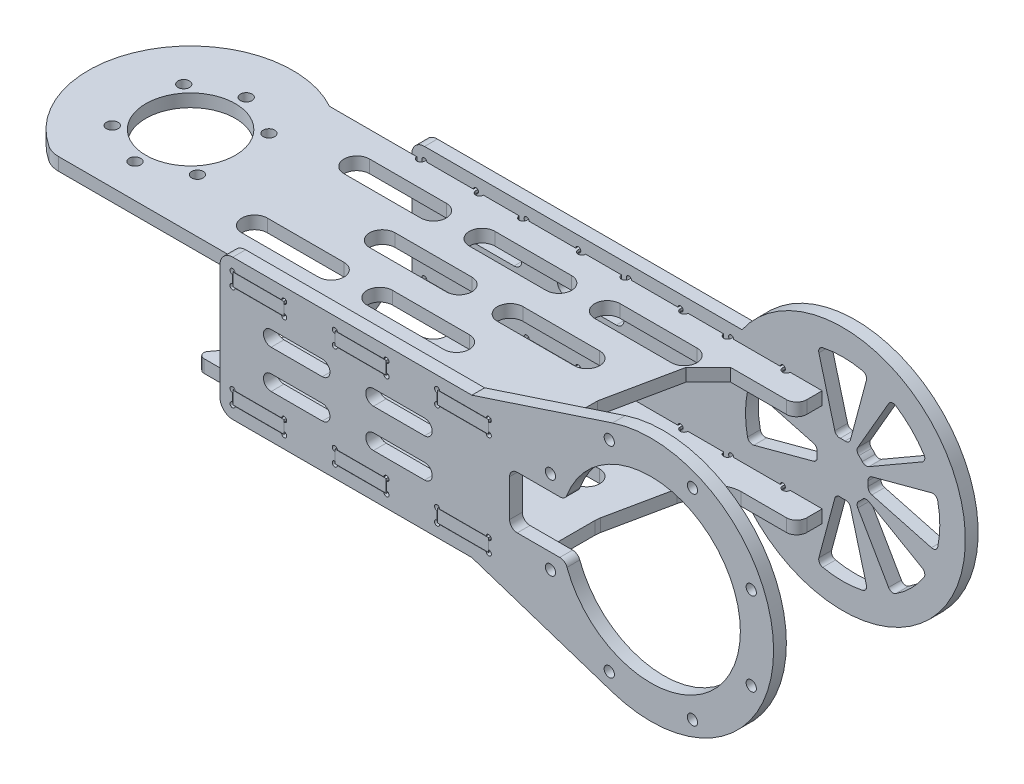
from build123d import *

# Parameters (mm, degrees)
SKETCH_1_W             = 270
SKETCH_1_H             = 5
EXTRUDE_1_DEPTH        = 200
SKETCH_2_R             = 2.25
SKETCH_2_R_2           = 17.5
CUT_EXTRUDE_1_DEPTH    = 10
FILLET_4_R             = 10
SKETCH_5_W             = 160
SKETCH_5_H             = 6
EXTRUDE_1_2_DEPTH      = 5
CUT_EXTRUDE_2_DEPTH    = 5
CUT_EXTRUDE_3_DEPTH    = 5
PATTERN_LINEAR_1_COUNT = 2
PATTERN_LINEAR_1_PITCH = 40
EXTRUDE_2_DEPTH        = 5
FILLET_5_R             = 5
CUT_EXTRUDE_4_DEPTH    = 347.258934903
FILLET_6_R             = 10
PATTERN_LINEAR_2_COUNT = 2
PATTERN_LINEAR_2_PITCH = 75
FILLET_9_R             = 4
FILLET_10_R            = 4
SKETCH_10_W            = 28.430397339
SKETCH_10_H            = 10.57159179
SKETCH_10_H_2          = 10.982139044
EXTRUDE_3_DEPTH        = 5
SKETCH_11_R            = 2
CUT_EXTRUDE_5_DEPTH    = 10
EXTRUDE_4_DEPTH        = 5
CUT_EXTRUDE_6_DEPTH    = 5
SKETCH_14_W            = 30.299348818
SKETCH_14_H            = 10.518193802
CUT_EXTRUDE_7_DEPTH    = 347.258934903
FILLET_11_R            = 4
CUT_EXTRUDE_8_DEPTH    = 290.119784864
SKETCH_16_R            = 50
CUT_EXTRUDE_9_DEPTH    = 5
EXTRUDE_5_DEPTH        = 5
FILLET_12_R            = 2


with BuildPart() as part:
    # 草图1 → Extrude 1 (new body)
    with BuildSketch(Plane.XY):
        with Locations((-135, -2.5)):
            Rectangle(SKETCH_1_W, SKETCH_1_H)
    extrude(amount=EXTRUDE_1_DEPTH)

    # 草图2 → 切除-拉伸1 (cut)
    with BuildSketch(Plane(origin=(0, 0, 0), x_dir=(1, 0, 0), z_dir=(0, 1, 0))):
        with BuildLine():
            Line((-270, 0), (-270, -165))
            ThreePointArc((-270, -165), (-250.315060063, -130.542804313), (-210.635083269, -130))
            Line((-210.635083269, -130), (0, -130))
            Line((0, -130), (0, 0))
            Line((0, 0), (-270, 0))
        make_face()
        with BuildLine():
            ThreePointArc((-249.364916731, -200), (-264.457195687, -185.315060063), (-270, -165))
            Line((-270, -165), (-270, -200))
            Line((-270, -200), (-249.364916731, -200))
        make_face()
        with Locations(Location((-246.661466638, -178.980630511, 0), (0, 0, 270))):
            Circle(SKETCH_2_R)
        with Locations(Location((-230, -165, 0), (0, 0, 270))):
            Circle(SKETCH_2_R_2)
        with Locations(Location((-246.661466638, -151.019369489, 0), (0, 0, 270))):
            Circle(SKETCH_2_R)
        with Locations(Location((-230, -143.25, 0), (0, 0, 270))):
            Circle(SKETCH_2_R)
        with Locations(Location((-213.338533362, -151.019369489, 0), (0, 0, 270))):
            Circle(SKETCH_2_R)
        with Locations(Location((-213.338533362, -178.980630511, 0), (0, 0, 270))):
            Circle(SKETCH_2_R)
        with Locations(Location((-230, -186.75, 0), (0, 0, 270))):
            Circle(SKETCH_2_R)
    extrude(amount=-CUT_EXTRUDE_1_DEPTH, mode=Mode.SUBTRACT)

    # 圆角4
    fillet_4_edges = [part.edges().sort_by_distance(p)[0] for p in [
        (-249.364916731, -2.5, 200),
    ]]
    fillet(fillet_4_edges, radius=FILLET_4_R)

    # 草图5 → Extrude 1 2 (add)
    with BuildSketch(Plane.XZ.offset(5)):
        with Locations((-100, 203)):
            Rectangle(SKETCH_5_W, SKETCH_5_H)
        with Locations((-100, 127)):
            Rectangle(SKETCH_5_W, SKETCH_5_H)
    extrude(amount=-EXTRUDE_1_2_DEPTH)

    # 草图6 → 切除-拉伸2 (cut)
    with BuildSketch(Plane.XZ.offset(5)):
        with BuildLine():
            Line((-180, 200), (-176.5, 200))
            ThreePointArc((-176.5, 200), (-175, 198.5), (-173.5, 200))
            Line((-173.5, 200), (-173.5, 205))
            Line((-173.5, 205), (-153.5, 205))
            Line((-153.5, 205), (-153.5, 200))
            ThreePointArc((-153.5, 200), (-152, 198.5), (-150.5, 200))
            Line((-150.5, 200), (-136.5, 200))
            ThreePointArc((-136.5, 200), (-135, 198.5), (-133.5, 200))
            Line((-133.5, 200), (-133.5, 205))
            Line((-133.5, 205), (-113.5, 205))
            Line((-113.5, 205), (-113.5, 200))
            ThreePointArc((-113.5, 200), (-112, 198.5), (-110.5, 200))
            Line((-110.5, 200), (-96.5, 200))
            ThreePointArc((-96.5, 200), (-95, 198.5), (-93.5, 200))
            Line((-93.5, 200), (-93.5, 205))
            Line((-93.5, 205), (-73.5, 205))
            Line((-73.5, 205), (-73.5, 200))
            ThreePointArc((-73.5, 200), (-72, 198.5), (-70.5, 200))
            Line((-70.5, 200), (-56.5, 200))
            ThreePointArc((-56.5, 200), (-55, 198.5), (-53.5, 200))
            Line((-53.5, 200), (-53.5, 205))
            Line((-53.5, 205), (-33.5, 205))
            Line((-33.5, 205), (-33.5, 200))
            ThreePointArc((-33.5, 200), (-32, 198.5), (-30.5, 200))
            Line((-30.5, 200), (-20, 200))
            Line((-20, 200), (-20, 206))
            Line((-20, 206), (-180, 206))
            Line((-180, 206), (-180, 200))
        make_face()
        with BuildLine():
            Line((-20, 124), (-20, 130))
            Line((-20, 130), (-30.5, 130))
            ThreePointArc((-30.5, 130), (-32, 131.5), (-33.5, 130))
            Line((-33.5, 130), (-33.5, 125))
            Line((-33.5, 125), (-53.5, 125))
            Line((-53.5, 125), (-53.5, 130))
            ThreePointArc((-53.5, 130), (-55, 131.5), (-56.5, 130))
            Line((-56.5, 130), (-70.5, 130))
            ThreePointArc((-70.5, 130), (-72, 131.5), (-73.5, 130))
            Line((-73.5, 130), (-73.5, 125))
            Line((-73.5, 125), (-93.5, 125))
            Line((-93.5, 125), (-93.5, 130))
            ThreePointArc((-93.5, 130), (-95, 131.5), (-96.5, 130))
            Line((-96.5, 130), (-110.5, 130))
            ThreePointArc((-110.5, 130), (-112, 131.5), (-113.5, 130))
            Line((-113.5, 130), (-113.5, 125))
            Line((-113.5, 125), (-133.5, 125))
            Line((-133.5, 125), (-133.5, 130))
            ThreePointArc((-133.5, 130), (-135, 131.5), (-136.5, 130))
            Line((-136.5, 130), (-150.5, 130))
            ThreePointArc((-150.5, 130), (-152, 131.5), (-153.5, 130))
            Line((-153.5, 130), (-153.5, 125))
            Line((-153.5, 125), (-173.5, 125))
            Line((-173.5, 125), (-173.5, 130))
            ThreePointArc((-173.5, 130), (-175, 131.5), (-176.5, 130))
            Line((-176.5, 130), (-180, 130))
            Line((-180, 130), (-180, 124))
            Line((-180, 124), (-20, 124))
        make_face()
    extrude(amount=-CUT_EXTRUDE_2_DEPTH, mode=Mode.SUBTRACT)

    # 草图7 → 切除-拉伸3 (cut)
    with BuildSketch(Plane.XZ.offset(5)):
        with BuildLine():
            Line((-185, 190), (-155, 190))
            ThreePointArc((-155, 190), (-150, 185), (-155, 180))
            Line((-155, 180), (-185, 180))
            ThreePointArc((-185, 180), (-190, 185), (-185, 190))
        make_face()
        with BuildLine():
            Line((-136, 190), (-106, 190))
            ThreePointArc((-106, 190), (-101, 185), (-106, 180))
            Line((-106, 180), (-136, 180))
            ThreePointArc((-136, 180), (-141, 185), (-136, 190))
        make_face()
        with BuildLine():
            Line((-155, 170), (-125, 170))
            ThreePointArc((-125, 170), (-120, 165), (-125, 160))
            Line((-125, 160), (-155, 160))
            ThreePointArc((-155, 160), (-160, 165), (-155, 170))
        make_face()
        with BuildLine():
            Line((-105, 170), (-75, 170))
            ThreePointArc((-75, 170), (-70, 165), (-75, 160))
            Line((-75, 160), (-105, 160))
            ThreePointArc((-105, 160), (-110, 165), (-105, 170))
        make_face()
        with BuildLine():
            Line((-87, 140), (-57, 140))
            ThreePointArc((-57, 140), (-52, 145), (-57, 150))
            Line((-57, 150), (-87, 150))
            ThreePointArc((-87, 150), (-92, 145), (-87, 140))
        make_face()
        with BuildLine():
            Line((-136, 140), (-106, 140))
            ThreePointArc((-106, 140), (-101, 145), (-106, 150))
            Line((-106, 150), (-136, 150))
            ThreePointArc((-136, 150), (-141, 145), (-136, 140))
        make_face()
        with BuildLine():
            Line((-185, 140), (-155, 140))
            ThreePointArc((-155, 140), (-150, 145), (-155, 150))
            Line((-155, 150), (-185, 150))
            ThreePointArc((-185, 150), (-190, 145), (-185, 140))
        make_face()
    extrude(amount=-CUT_EXTRUDE_3_DEPTH, mode=Mode.SUBTRACT)


with BuildPart() as pattern_linear_1_1:
    # 阵列(线性)1: pattern copy
    add(part.part.moved(Location(Vector(0, 1, 0) * (1 * PATTERN_LINEAR_1_PITCH))))


with BuildPart() as body_3:
    # 草图8 → 凸台-拉伸2 (new body)
    with BuildSketch(Plane.XY.offset(205)):
        with BuildLine():
            Line((-178.5, 45), (-49.341453964, 45))
            ThreePointArc((-49.341453964, 45), (38, 17.5), (-49.341453964, -10))
            Line((-49.341453964, -10), (-178.5, -10))
            Line((-178.5, -10), (-178.5, 45))
        make_face()
        with BuildLine():
            Line((-173.6, -0.9), (-173.6, -4.1))
            ThreePointArc((-173.6, -4.1), (-174.307106781, -5.807106781), (-172.6, -5.1))
            Line((-172.6, -5.1), (-154.4, -5.1))
            ThreePointArc((-154.4, -5.1), (-152.692893219, -5.807106781), (-153.4, -4.1))
            Line((-153.4, -4.1), (-153.4, -0.9))
            ThreePointArc((-153.4, -0.9), (-152.692893219, 0.807106781), (-154.4, 0.1))
            Line((-154.4, 0.1), (-172.6, 0.1))
            ThreePointArc((-172.6, 0.1), (-174.307106781, 0.807106781), (-173.6, -0.9))
        make_face(mode=Mode.SUBTRACT)
        with BuildLine():
            Line((-133.6, -0.9), (-133.6, -4.1))
            ThreePointArc((-133.6, -4.1), (-134.307106781, -5.807106781), (-132.6, -5.1))
            Line((-132.6, -5.1), (-114.4, -5.1))
            ThreePointArc((-114.4, -5.1), (-112.692893219, -5.807106781), (-113.4, -4.1))
            Line((-113.4, -4.1), (-113.4, -0.9))
            ThreePointArc((-113.4, -0.9), (-112.692893219, 0.807106781), (-114.4, 0.1))
            Line((-114.4, 0.1), (-132.6, 0.1))
            ThreePointArc((-132.6, 0.1), (-134.307106781, 0.807106781), (-133.6, -0.9))
        make_face(mode=Mode.SUBTRACT)
        with BuildLine():
            Line((-93.6, -0.9), (-93.6, -4.1))
            ThreePointArc((-93.6, -4.1), (-94.307106781, -5.807106781), (-92.6, -5.1))
            Line((-92.6, -5.1), (-74.4, -5.1))
            ThreePointArc((-74.4, -5.1), (-72.692893219, -5.807106781), (-73.4, -4.1))
            Line((-73.4, -4.1), (-73.4, -0.9))
            ThreePointArc((-73.4, -0.9), (-72.692893219, 0.807106781), (-74.4, 0.1))
            Line((-74.4, 0.1), (-92.6, 0.1))
            ThreePointArc((-92.6, 0.1), (-94.307106781, 0.807106781), (-93.6, -0.9))
        make_face(mode=Mode.SUBTRACT)
        with BuildLine():
            Line((-53.6, -0.9), (-53.6, -4.1))
            ThreePointArc((-53.6, -4.1), (-54.307106781, -5.807106781), (-52.6, -5.1))
            Line((-52.6, -5.1), (-34.4, -5.1))
            ThreePointArc((-34.4, -5.1), (-32.692893219, -5.807106781), (-33.4, -4.1))
            Line((-33.4, -4.1), (-33.4, -0.9))
            ThreePointArc((-33.4, -0.9), (-32.692893219, 0.807106781), (-34.4, 0.1))
            Line((-34.4, 0.1), (-52.6, 0.1))
            ThreePointArc((-52.6, 0.1), (-54.307106781, 0.807106781), (-53.6, -0.9))
        make_face(mode=Mode.SUBTRACT)
        with BuildLine():
            Line((-133.6, 39.1), (-133.6, 35.9))
            ThreePointArc((-133.6, 35.9), (-134.307106781, 34.192893219), (-132.6, 34.9))
            Line((-132.6, 34.9), (-114.4, 34.9))
            ThreePointArc((-114.4, 34.9), (-112.692893219, 34.192893219), (-113.4, 35.9))
            Line((-113.4, 35.9), (-113.4, 39.1))
            ThreePointArc((-113.4, 39.1), (-112.692893219, 40.807106781), (-114.4, 40.1))
            Line((-114.4, 40.1), (-132.6, 40.1))
            ThreePointArc((-132.6, 40.1), (-134.307106781, 40.807106781), (-133.6, 39.1))
        make_face(mode=Mode.SUBTRACT)
        with BuildLine():
            Line((-93.6, 39.1), (-93.6, 35.9))
            ThreePointArc((-93.6, 35.9), (-94.307106781, 34.192893219), (-92.6, 34.9))
            Line((-92.6, 34.9), (-74.4, 34.9))
            ThreePointArc((-74.4, 34.9), (-72.692893219, 34.192893219), (-73.4, 35.9))
            Line((-73.4, 35.9), (-73.4, 39.1))
            ThreePointArc((-73.4, 39.1), (-72.692893219, 40.807106781), (-74.4, 40.1))
            Line((-74.4, 40.1), (-92.6, 40.1))
            ThreePointArc((-92.6, 40.1), (-94.307106781, 40.807106781), (-93.6, 39.1))
        make_face(mode=Mode.SUBTRACT)
        with BuildLine():
            Line((-53.6, 39.1), (-53.6, 35.9))
            ThreePointArc((-53.6, 35.9), (-54.307106781, 34.192893219), (-52.6, 34.9))
            Line((-52.6, 34.9), (-34.4, 34.9))
            ThreePointArc((-34.4, 34.9), (-32.692893219, 34.192893219), (-33.4, 35.9))
            Line((-33.4, 35.9), (-33.4, 39.1))
            ThreePointArc((-33.4, 39.1), (-32.692893219, 40.807106781), (-34.4, 40.1))
            Line((-34.4, 40.1), (-52.6, 40.1))
            ThreePointArc((-52.6, 40.1), (-54.307106781, 40.807106781), (-53.6, 39.1))
        make_face(mode=Mode.SUBTRACT)
        with BuildLine():
            Line((-173.6, 39.1), (-173.6, 35.9))
            ThreePointArc((-173.6, 35.9), (-174.307106781, 34.192893219), (-172.6, 34.9))
            Line((-172.6, 34.9), (-154.4, 34.9))
            ThreePointArc((-154.4, 34.9), (-152.692893219, 34.192893219), (-153.4, 35.9))
            Line((-153.4, 35.9), (-153.4, 39.1))
            ThreePointArc((-153.4, 39.1), (-152.692893219, 40.807106781), (-154.4, 40.1))
            Line((-154.4, 40.1), (-172.6, 40.1))
            ThreePointArc((-172.6, 40.1), (-174.307106781, 40.807106781), (-173.6, 39.1))
        make_face(mode=Mode.SUBTRACT)
    extrude(amount=-EXTRUDE_2_DEPTH)

    # 圆角5
    fillet_5_edges = [body_3.edges().sort_by_distance(p)[0] for p in [
        (-178.5, 45, 202.5),
        (-178.5, -10, 202.5),
    ]]
    fillet(fillet_5_edges, radius=FILLET_5_R)


with BuildPart() as cut_extrude_4_tool:
    # 草图9 → 切除-拉伸4 (new, through all)
    with BuildSketch(Plane(origin=(0, 40, 0), x_dir=(1, 0, 0), z_dir=(0, 1, 0))):
        Polygon((-58.5, -217.937724261), (0, -217.937724261), (0, -140), (-43.841989731, -140), (-52.541893066, -148.699903335), (-58.5, -177.324686964), align=None)
    extrude(amount=-CUT_EXTRUDE_4_DEPTH)


with BuildPart() as pattern_linear_1_1_1:
    add(pattern_linear_1_1.part)

    # 切除-拉伸4: cut by cut_extrude_4_tool
    add(cut_extrude_4_tool.part, mode=Mode.SUBTRACT)

    # 圆角10
    fillet_10_edges = [pattern_linear_1_1_1.edges().sort_by_distance(p)[0] for p in [
        (0, 37.5, 140),
    ]]
    fillet(fillet_10_edges, radius=FILLET_10_R)


with BuildPart() as part_1:
    add(part.part)

    # 切除-拉伸4: cut by cut_extrude_4_tool
    add(cut_extrude_4_tool.part, mode=Mode.SUBTRACT)

    # 圆角6
    fillet_6_edges = [part_1.edges().sort_by_distance(p)[0] for p in [
        (-58.5, -2.5, 177.324686964),
        (-52.541893066, -2.5, 148.699903335),
        (-43.841989731, -2.5, 140),
    ]]
    fillet(fillet_6_edges, radius=FILLET_6_R)

    # 圆角9
    fillet_9_edges = [part_1.edges().sort_by_distance(p)[0] for p in [
        (0, -2.5, 140),
    ]]
    fillet(fillet_9_edges, radius=FILLET_9_R)


with BuildPart() as pattern_linear_2_1:
    # 阵列(线性)2: pattern copy
    add(body_3.part.moved(Location(Vector(0, 0, -1) * (1 * PATTERN_LINEAR_2_PITCH))))

    # 草图13 → 切除-拉伸6 (cut)
    with BuildSketch(Plane(origin=(0, 0, 125), x_dir=(-1, 0, 0), z_dir=(0, 0, -1))):
        with BuildLine():
            Line((-21.128764833, 35.472200756), (-0.246950766, 23.416079783))
            ThreePointArc((-0.246950766, 23.416079783), (1.107320607, 23.179757711), (2.294207695, 23.873442159))
            ThreePointArc((2.294207695, 23.873442159), (2.928932188, 24.571067812), (3.626557841, 25.205792305))
            ThreePointArc((3.626557841, 25.205792305), (4.320242289, 26.392679393), (4.083920217, 27.746950766))
            Line((4.083920217, 27.746950766), (-7.972200756, 48.628764833))
            ThreePointArc((-7.972200756, 48.628764833), (-9.240496649, 49.574254843), (-10.798932206, 49.302585101))
            ThreePointArc((-10.798932206, 49.302585101), (-16.870057685, 44.370057685), (-21.802585101, 38.298932206))
            ThreePointArc((-21.802585101, 38.298932206), (-22.074254843, 36.740496649), (-21.128764833, 35.472200756))
        make_face()
        with BuildLine():
            Line((0.696904324, 52.21962573), (6.93761176, 28.928988506))
            ThreePointArc((6.93761176, 28.928988506), (7.728121291, 27.804269095), (9.057886177, 27.455522163))
            ThreePointArc((9.057886177, 27.455522163), (10, 27.5), (10.942113823, 27.455522163))
            ThreePointArc((10.942113823, 27.455522163), (12.271878709, 27.804269095), (13.06238824, 28.928988506))
            Line((13.06238824, 28.928988506), (19.303095676, 52.21962573))
            ThreePointArc((19.303095676, 52.21962573), (19.074837447, 53.785008755), (17.78075758, 54.694889588))
            ThreePointArc((17.78075758, 54.694889588), (10, 55.5), (2.21924242, 54.694889588))
            ThreePointArc((2.21924242, 54.694889588), (0.925162553, 53.785008755), (0.696904324, 52.21962573))
        make_face()
        with BuildLine():
            Line((44.71962573, 26.803095676), (21.428988506, 20.56238824))
            ThreePointArc((21.428988506, 20.56238824), (20.304269095, 19.771878709), (19.955522163, 18.442113823))
            ThreePointArc((19.955522163, 18.442113823), (20, 17.5), (19.955522163, 16.557886177))
            ThreePointArc((19.955522163, 16.557886177), (20.304269095, 15.228121291), (21.428988506, 14.43761176))
            Line((21.428988506, 14.43761176), (44.71962573, 8.196904324))
            ThreePointArc((44.71962573, 8.196904324), (46.285008755, 8.425162553), (47.194889588, 9.71924242))
            ThreePointArc((47.194889588, 9.71924242), (48, 17.5), (47.194889588, 25.28075758))
            ThreePointArc((47.194889588, 25.28075758), (46.285008755, 26.574837447), (44.71962573, 26.803095676))
        make_face()
        with BuildLine():
            Line((19.303095676, -17.21962573), (13.06238824, 6.071011494))
            ThreePointArc((13.06238824, 6.071011494), (12.271878709, 7.195730905), (10.942113823, 7.544477837))
            ThreePointArc((10.942113823, 7.544477837), (10, 7.5), (9.057886177, 7.544477837))
            ThreePointArc((9.057886177, 7.544477837), (7.728121291, 7.195730905), (6.93761176, 6.071011494))
            Line((6.93761176, 6.071011494), (0.696904324, -17.21962573))
            ThreePointArc((0.696904324, -17.21962573), (0.925162553, -18.785008755), (2.21924242, -19.694889588))
            ThreePointArc((2.21924242, -19.694889588), (10, -20.5), (17.78075758, -19.694889588))
            ThreePointArc((17.78075758, -19.694889588), (19.074837447, -18.785008755), (19.303095676, -17.21962573))
        make_face()
        with BuildLine():
            Line((-7.972200756, -13.628764833), (4.083920217, 7.253049234))
            ThreePointArc((4.083920217, 7.253049234), (4.320242289, 8.607320607), (3.626557841, 9.794207695))
            ThreePointArc((3.626557841, 9.794207695), (2.928932188, 10.428932188), (2.294207695, 11.126557841))
            ThreePointArc((2.294207695, 11.126557841), (1.107320607, 11.820242289), (-0.246950766, 11.583920217))
            Line((-0.246950766, 11.583920217), (-21.128764833, -0.472200756))
            ThreePointArc((-21.128764833, -0.472200756), (-22.074254843, -1.740496649), (-21.802585101, -3.298932206))
            ThreePointArc((-21.802585101, -3.298932206), (-16.870057685, -9.370057685), (-10.798932206, -14.302585101))
            ThreePointArc((-10.798932206, -14.302585101), (-9.240496649, -14.574254843), (-7.972200756, -13.628764833))
        make_face()
        with BuildLine():
            Line((-24.71962573, 8.196904324), (-1.428988506, 14.43761176))
            ThreePointArc((-1.428988506, 14.43761176), (-0.304269095, 15.228121291), (0.044477837, 16.557886177))
            ThreePointArc((0.044477837, 16.557886177), (0, 17.5), (0.044477837, 18.442113823))
            ThreePointArc((0.044477837, 18.442113823), (-0.304269095, 19.771878709), (-1.428988506, 20.56238824))
            Line((-1.428988506, 20.56238824), (-24.71962573, 26.803095676))
            ThreePointArc((-24.71962573, 26.803095676), (-26.285008755, 26.574837447), (-27.194889588, 25.28075758))
            ThreePointArc((-27.194889588, 25.28075758), (-28, 17.5), (-27.194889588, 9.71924242))
            ThreePointArc((-27.194889588, 9.71924242), (-26.285008755, 8.425162553), (-24.71962573, 8.196904324))
        make_face()
    extrude(amount=-CUT_EXTRUDE_6_DEPTH, mode=Mode.SUBTRACT)


with BuildPart() as body_3_1:
    add(body_3.part)

    add(pattern_linear_1_1_1.part)  # 凸台-拉伸3 merges 阵列(线性)1_1

    add(part_1.part)  # 凸台-拉伸3 merges part
    # 草图10 → 凸台-拉伸3 (add)
    with BuildSketch(Plane(origin=(0, 0, 200), x_dir=(-1, 0, 0), z_dir=(0, 0, -1))):
        with Locations((42.527278264, 37.606498081)):
            Rectangle(SKETCH_10_W, SKETCH_10_H)
        with Locations((42.527278264, -2.011311929)):
            Rectangle(SKETCH_10_W, SKETCH_10_H_2)
    extrude(amount=-EXTRUDE_3_DEPTH)

    # 草图11 → 切除-拉伸5 (cut)
    with BuildSketch(Plane.XY.offset(205)):
        with Locations((6.264045876, 56.764880132)):
            Circle(SKETCH_11_R)
        with Locations((29.264880132, 33.764045876)):
            Circle(SKETCH_11_R)
        with Locations((29.264880132, 1.235954124)):
            Circle(SKETCH_11_R)
        with Locations((6.264045876, -21.764880132)):
            Circle(SKETCH_11_R)
        with Locations((-26.264045876, -21.764880132)):
            Circle(SKETCH_11_R)
        with Locations((-49.264880132, 1.235954124)):
            Circle(SKETCH_11_R)
        with Locations((-49.264880132, 33.764045876)):
            Circle(SKETCH_11_R)
        with Locations((-26.264045876, 56.764880132)):
            Circle(SKETCH_11_R)
        with BuildLine():
            Line((-62.264880132, 27.764045876), (-45.609901531, 27.764045876))
            ThreePointArc((-45.609901531, 27.764045876), (-43.898394088, 28.300158241), (-42.798593515, 29.716884359))
            ThreePointArc((-42.798593515, 29.716884359), (25, 17.5), (-42.798593515, 5.283115641))
            ThreePointArc((-42.798593515, 5.283115641), (-43.898394088, 6.699841759), (-45.609901531, 7.235954124))
            Line((-45.609901531, 7.235954124), (-62.264880132, 7.235954124))
            ThreePointArc((-62.264880132, 7.235954124), (-64.386200475, 8.114633781), (-65.264880132, 10.235954124))
            Line((-65.264880132, 10.235954124), (-65.264880132, 24.764045876))
            ThreePointArc((-65.264880132, 24.764045876), (-64.386200475, 26.885366219), (-62.264880132, 27.764045876))
        make_face()
    extrude(amount=-CUT_EXTRUDE_5_DEPTH, mode=Mode.SUBTRACT)

    # 草图12 → 凸台-拉伸4 (add)
    with BuildSketch(Plane.XY.offset(205)):
        with BuildLine():
            Line((-80, 45), (-25.001781013, 63.095466512))
            ThreePointArc((-25.001781013, 63.095466512), (-38.638405577, 56.020666219), (-49.341453964, 45))
            Line((-49.341453964, 45), (-80, 45))
        make_face()
        with BuildLine():
            Line((-80, -10), (-25.001781013, -28.095466512))
            ThreePointArc((-25.001781013, -28.095466512), (-38.638405577, -21.020666219), (-49.341453964, -10))
            Line((-49.341453964, -10), (-80, -10))
        make_face()
    extrude(amount=-EXTRUDE_4_DEPTH)

    # 草图14 → 切除-拉伸7 (cut, through all)
    with BuildSketch(Plane(origin=(0, 40, 0), x_dir=(1, 0, 0), z_dir=(0, 1, 0))):
        with Locations((-2.850325591, -135.259096901)):
            Rectangle(SKETCH_14_W, SKETCH_14_H)
    extrude(amount=-CUT_EXTRUDE_7_DEPTH, mode=Mode.SUBTRACT)

    # 圆角11
    fillet_11_edges = [body_3_1.edges().sort_by_distance(p)[0] for p in [
        (-18, -2.5, 140),
        (-18, 37.5, 140),
    ]]
    fillet(fillet_11_edges, radius=FILLET_11_R)


with BuildPart() as cut_extrude_8_tool:
    # 草图15 → 切除-拉伸8 (new, through all)
    with BuildSketch(Plane(origin=(0, 0, 125), x_dir=(-1, 0, 0), z_dir=(0, 0, -1))):
        with BuildLine():
            Line((98.5, 28), (118.5, 28))
            ThreePointArc((118.5, 28), (121.5, 25), (118.5, 22))
            Line((118.5, 22), (98.5, 22))
            ThreePointArc((98.5, 22), (95.5, 25), (98.5, 28))
        make_face()
        with BuildLine():
            Line((138.5, 28), (158.5, 28))
            ThreePointArc((158.5, 28), (161.5, 25), (158.5, 22))
            Line((158.5, 22), (138.5, 22))
            ThreePointArc((138.5, 22), (135.5, 25), (138.5, 28))
        make_face()
        with BuildLine():
            Line((98.5, 13), (118.5, 13))
            ThreePointArc((118.5, 13), (121.5, 10), (118.5, 7))
            Line((118.5, 7), (98.5, 7))
            ThreePointArc((98.5, 7), (95.5, 10), (98.5, 13))
        make_face()
        with BuildLine():
            Line((138.5, 13), (158.5, 13))
            ThreePointArc((158.5, 13), (161.5, 10), (158.5, 7))
            Line((158.5, 7), (138.5, 7))
            ThreePointArc((138.5, 7), (135.5, 10), (138.5, 13))
        make_face()
    extrude(amount=-CUT_EXTRUDE_8_DEPTH)


with BuildPart() as body_3_2:
    add(body_3_1.part)

    # 切除-拉伸8: cut by cut_extrude_8_tool
    add(cut_extrude_8_tool.part, mode=Mode.SUBTRACT)

    # 草图16 → 切除-拉伸9 (cut)
    with BuildSketch(Plane(origin=(0, 0, 0), x_dir=(1, 0, 0), z_dir=(0, 1, 0))):
        with Locations((-230, -165)):
            Circle(SKETCH_16_R)
    extrude(amount=-CUT_EXTRUDE_9_DEPTH, mode=Mode.SUBTRACT)


with BuildPart() as pattern_linear_2_1_1:
    add(pattern_linear_2_1.part)

    # 切除-拉伸8: cut by cut_extrude_8_tool
    add(cut_extrude_8_tool.part, mode=Mode.SUBTRACT)


    add(body_3_2.part)  # 凸台-拉伸5 merges body 3
    # 草图17 → 凸台-拉伸5 (add)
    with BuildSketch(Plane(origin=(0, 0, 0), x_dir=(1, 0, 0), z_dir=(0, 1, 0))):
        with BuildLine():
            Line((-194.292857857, -130), (-186.285014011, -130))
            ThreePointArc((-186.285014011, -130), (-174, -165), (-186.285014011, -200))
            Line((-186.285014011, -200), (-194.292857857, -200))
            ThreePointArc((-194.292857857, -200), (-180, -165), (-194.292857857, -130))
        make_face()
    extrude(amount=-EXTRUDE_5_DEPTH)

    # 圆角12
    fillet_12_edges = [pattern_linear_2_1_1.edges().sort_by_distance(p)[0] for p in [
        (-194.292857857, -2.5, 130),
        (-194.292857857, -2.5, 200),
    ]]
    fillet(fillet_12_edges, radius=FILLET_12_R)


solid = pattern_linear_2_1_1.part
